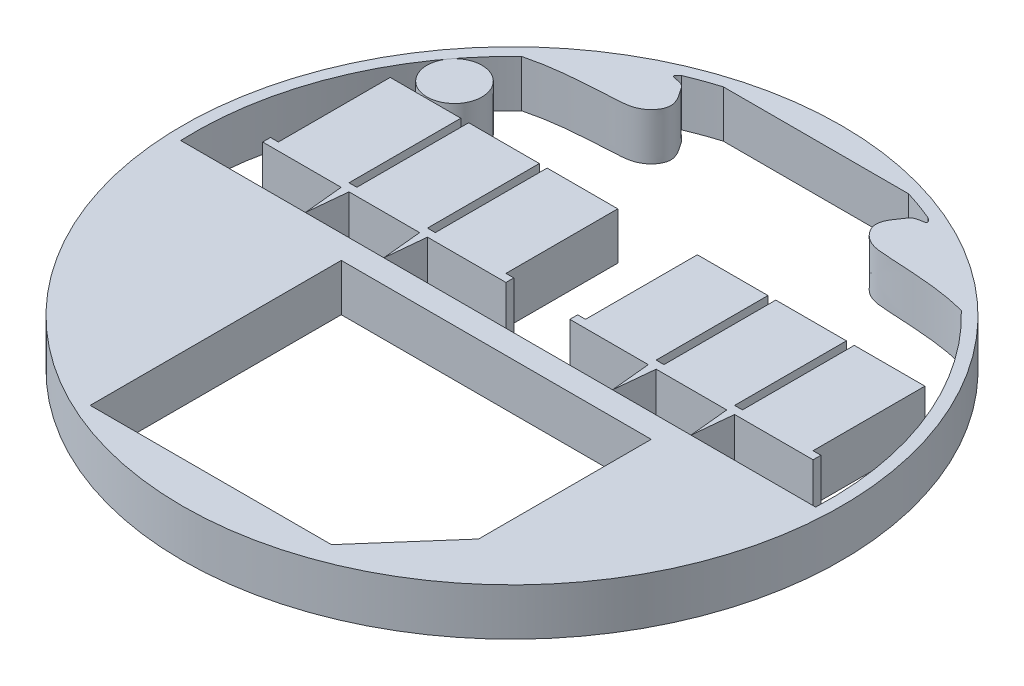
from build123d import *

# Parameters (mm, degrees)
CARGO_OUTLINE_R = 2133.6
CARGO_DEPTH     = 304.8
SKETCH2_W       = 50.8
SKETCH2_H       = 50.8
SKETCH2_R       = 177.8
SEAT_DEPTH      = 304.8


# Read off the part's stored shape, not the designer's step: Cargo
with BuildPart() as part:
    # Cargo outline → Cargo (new body)
    with BuildSketch(Plane(origin=(0, 0, 0), x_dir=(1, 0, 0), z_dir=(0, 1, 0))):
        Circle(CARGO_OUTLINE_R)
        Polygon((-863.41216083, -241.861967626), (1143.18783917, -241.861967626), (1143.18783917, -1359.461967626), (698.68783917, -1867.461967626), (-863.41216083, -1867.461967626), align=None, mode=Mode.SUBTRACT)
        with BuildLine():
            Line((2055.45404141, -89.461967626), (-2055.45404141, -89.461967626))
            ThreePointArc((-2055.45404141, -89.461967626), (-1909.442475795, 766.109777793), (-1423.610090433, 1485.338032374))
            add(Edge.make_bspline(
                [(-798.217508325, 1896.114100869), (-818.771129217, 1880.333806275), (-832.200867962, 1856.089429345), (-751.773824413, 1858.966519018), (-705.522103109, 1789.487646844), (-633.222435971, 1693.292486424), (-735.178144682, 1557.532639804), (-1019.196559122, 1540.297317862), (-1243.116022928, 1532.007926733), (-1423.610090433, 1485.338032374)],
                knots=[0, 0, 0, 0, 0.033163544, 0.09284489, 0.136900302, 0.260923978, 0.370970942, 0.51254498, 0.999797782, 0.999797782, 0.999797782, 0.999797782], degree=3))
            ThreePointArc((-798.217508325, 1896.114100869), (-699.872252923, 1934.574553668), (-599.683061997, 1967.938032374))
            Line((-599.683061997, 1967.938032374), (599.683061997, 1967.938032374))
            ThreePointArc((599.683061997, 1967.938032374), (699.872252923, 1934.574553668), (798.217508325, 1896.114100869))
            add(Edge.make_bspline(
                [(1423.610090433, 1485.338032374), (1243.116022928, 1532.007926733), (1019.196559122, 1540.297317862), (735.178144682, 1557.532639804), (633.222435971, 1693.292486424), (705.522103109, 1789.487646844), (751.773824413, 1858.966519018), (832.200867962, 1856.089429345), (818.771129217, 1880.333806275), (798.217508325, 1896.114100869)],
                knots=[0, 0, 0, 0, 0.487252802, 0.62882684, 0.738873805, 0.86289748, 0.906952892, 0.966634238, 0.999797782, 0.999797782, 0.999797782, 0.999797782], degree=3))
            ThreePointArc((1423.610090433, 1485.338032374), (1909.442475795, 766.109777793), (2055.45404141, -89.461967626))
        make_face(mode=Mode.SUBTRACT)
    extrude(amount=CARGO_DEPTH)


with BuildPart() as body_2:
    # Sketch2 → Seat (new body)
    with BuildSketch(Plane(origin=(0, 0, 0), x_dir=(1, 0, 0), z_dir=(0, 1, 0))):
        with Locations((740.194440879, 192.901688385)):
            Rectangle(SKETCH2_W, SKETCH2_H)
        Polygon((714.794440879, 167.501688385), (714.794440879, 218.301688385), (714.794440879, 942.344091601), (257.594440879, 942.344091601), (257.594440879, 218.301688385), (257.594440879, 167.501688385), align=None)
        Polygon((765.594440879, 942.344091601), (765.594440879, 218.301688385), (765.594440879, 167.501688385), (1222.794440879, 167.501688385), (1222.794440879, 218.301688385), (1222.794440879, 942.344091601), align=None)
        Polygon((765.594440879, 167.501688385), (714.794440879, 167.501688385), (740.194440879, -89.461967626), align=None)
        with Locations((232.194440879, 192.901688385)):
            Rectangle(SKETCH2_W, SKETCH2_H)
        with Locations((1248.194440879, 192.901688385)):
            Rectangle(SKETCH2_W, SKETCH2_H)
        Polygon((1273.594440879, 167.501688385), (1222.794440879, 167.501688385), (1248.194440879, -89.461967626), align=None)
        Polygon((1273.594440879, 218.301688385), (1273.594440879, 167.501688385), (1730.794440879, 167.501688385), (1730.794440879, 218.301688385), (1730.794440879, 942.344091601), (1273.594440879, 942.344091601), align=None)
        with Locations((1756.194440879, 192.901688385)):
            Rectangle(SKETCH2_W, SKETCH2_H)
        with Locations((-232.194440879, 192.901688385)):
            Rectangle(SKETCH2_W, SKETCH2_H)
        Polygon((-714.794440879, 167.501688385), (-257.594440879, 167.501688385), (-257.594440879, 218.301688385), (-257.594440879, 942.344091601), (-714.794440879, 942.344091601), (-714.794440879, 218.301688385), align=None)
        with Locations((-740.194440879, 192.901688385)):
            Rectangle(SKETCH2_W, SKETCH2_H)
        Polygon((-740.194440879, -89.461967626), (-714.794440879, 167.501688385), (-765.594440879, 167.501688385), align=None)
        Polygon((-1222.794440879, 167.501688385), (-765.594440879, 167.501688385), (-765.594440879, 218.301688385), (-765.594440879, 942.344091601), (-1222.794440879, 942.344091601), (-1222.794440879, 218.301688385), align=None)
        with Locations((-1248.194440879, 192.901688385)):
            Rectangle(SKETCH2_W, SKETCH2_H)
        Polygon((-1248.194440879, -89.461967626), (-1222.794440879, 167.501688385), (-1273.594440879, 167.501688385), align=None)
        Polygon((-1730.794440879, 167.501688385), (-1273.594440879, 167.501688385), (-1273.594440879, 218.301688385), (-1273.594440879, 942.344091601), (-1730.794440879, 942.344091601), (-1730.794440879, 218.301688385), align=None)
        with Locations((-1756.194440879, 192.901688385)):
            Rectangle(SKETCH2_W, SKETCH2_H)
        with Locations(Location((-1502.194440879, 1129.738032374, 0), (0, 0, 90))):
            Circle(SKETCH2_R)
    extrude(amount=SEAT_DEPTH)


solid = Compound([part.part, body_2.part])
